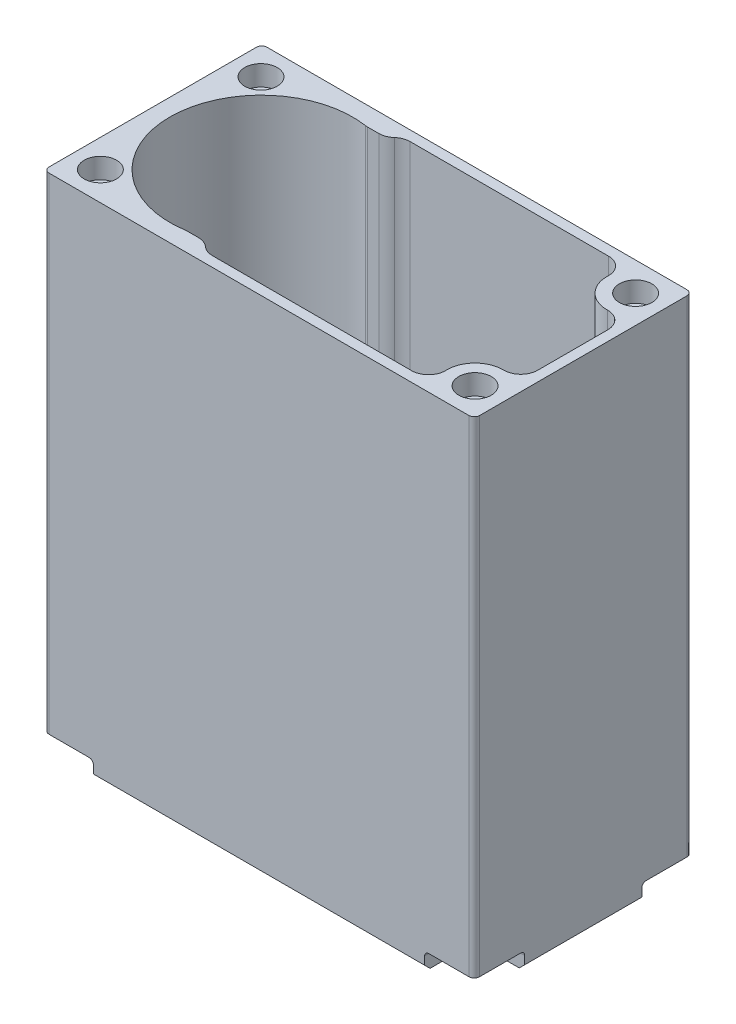
from build123d import *

# Parameters (mm, degrees)
SKETCH1_W             = 40.386
SKETCH1_H             = 20.447
BOSS_EXTRUDE1_DEPTH   = 47.244
FILLET1_R             = 0.508
CHAMFER1_SIZE         = 0.508
F_2_CLEARANCE_HOLE1_D = 2.2606
SKETCH6_R             = 8.5725
CUT_EXTRUDE1_DEPTH    = 45.974
SKETCH8_R             = 1.524
CUT_EXTRUDE2_DEPTH    = 1.905
CUT_EXTRUDE4_DEPTH    = 45.974
FILLET3_R             = 1.5875
FILLET6_R             = 1.5875
FILLET4_R             = 0.381
SKETCH9_R             = 1.1303
CUT_EXTRUDE5_DEPTH    = 1.651
FILLET5_R             = 0.381
CUT_EXTRUDE8_REACH    = 61.664
SKETCH12_R            = 7.62


with BuildPart() as part:
    # Sketch1 → Boss-Extrude1 (new body)
    with BuildSketch(Plane(origin=(0, 0, 0), x_dir=(1, 0, 0), z_dir=(0, 1, 0))):
        Rectangle(SKETCH1_W, SKETCH1_H)
    extrude(amount=BOSS_EXTRUDE1_DEPTH)

    # Fillet1
    fillet1_edges = [part.edges().sort_by_distance(p)[0] for p in [
        (20.193, 23.622, 10.2235),
        (-20.193, 23.622, 10.2235),
        (-20.193, 23.622, -10.2235),
        (20.193, 23.622, -10.2235),
    ]]
    fillet(fillet1_edges, radius=FILLET1_R)

    # Chamfer1
    chamfer1_edges = [part.edges().sort_by_distance(p)[0] for p in [
        (20.193, 0, 0),
        (0, 0, 10.2235),
        (-20.193, 0, 0),
        (0, 0, -10.2235),
        (-20.044210245, 0, 10.074710245),
        (-20.044210245, 0, -10.074710245),
        (20.044210245, 0, -10.074710245),
        (20.044210245, 0, 10.074710245),
    ]]
    chamfer(chamfer1_edges, length=CHAMFER1_SIZE)

    # #2 Clearance Hole1 (through all)
    with Locations(Plane(origin=(0, 47.244, 0), x_dir=(1, 0, 0), z_dir=(0, 1, 0))):
        with Locations((17.57045, -7.5311), (-17.57045, 7.5311), (-17.57045, -7.5311), (17.57045, 7.5311)):
            Hole(F_2_CLEARANCE_HOLE1_D / 2)

    # Sketch6 → Cut-Extrude1 (cut)
    with BuildSketch(Plane(origin=(0, 47.244, 0), x_dir=(1, 0, 0), z_dir=(0, 1, 0))):
        with Locations(Location((-10.014739789, 0, 0), (0, 0, 270))):
            Circle(SKETCH6_R)
    extrude(amount=-CUT_EXTRUDE1_DEPTH, mode=Mode.SUBTRACT)

    # Sketch8 → Cut-Extrude2 (cut)
    with BuildSketch(Plane(origin=(0, 47.244, 0), x_dir=(1, 0, 0), z_dir=(0, 1, 0))):
        with Locations(Location((-17.57045, -7.5311, 0), (0, 0, 270))):
            Circle(SKETCH8_R)
        with Locations(Location((-17.57045, 7.5311, 0), (0, 0, 270))):
            Circle(SKETCH8_R)
        with Locations(Location((17.57045, 7.5311, 0), (0, 0, 270))):
            Circle(SKETCH8_R)
        with Locations(Location((17.57045, -7.5311, 0), (0, 0, 270))):
            Circle(SKETCH8_R)
    extrude(amount=-CUT_EXTRUDE2_DEPTH, mode=Mode.SUBTRACT)

    # Sketch10 → Cut-Extrude4 (cut)
    with BuildSketch(Plane(origin=(0, 47.244, 0), x_dir=(1, 0, 0), z_dir=(0, 1, 0))):
        with BuildLine():
            Line((-6.70924359, 8.457326211), (-8.61424359, 8.457326211))
            ThreePointArc((-8.61424359, 8.457326211), (-3.476639533, 5.544456808), (-1.442239789, 0))
            ThreePointArc((-1.442239789, 0), (-3.476639533, -5.544456808), (-8.61424359, -8.457326211))
            Line((-8.61424359, -8.457326211), (-6.70924359, -8.457326211))
            Line((-6.70924359, -8.457326211), (-6.70924359, -9.271))
            Line((-6.70924359, -9.271), (15.608176703, -9.271))
            ThreePointArc((15.608176703, -9.271), (15.68428435, -5.70897277), (19.241559877, -5.509922056))
            Line((19.241559877, -5.509922056), (19.241559877, 5.420079029))
            ThreePointArc((19.241559877, 5.420079029), (15.63546106, 5.658979394), (15.51575641, 9.271))
            Line((15.51575641, 9.271), (-6.70924359, 9.271))
            Line((-6.70924359, 9.271), (-6.70924359, 8.457326211))
        make_face()
    extrude(amount=-CUT_EXTRUDE4_DEPTH, mode=Mode.SUBTRACT)

    # Fillet3
    # the kernel refuses this fillet: 1.5875 mm, written as the material it adds along each edge
    with BuildSketch(Plane(origin=(-6.70924359, 47.244, -9.271), x_dir=(0, 0, 1), z_dir=(0, -1, 0))) as fillet3_piece_1:
        with BuildLine():
            CenterArc((1.5875, -1.386127427), FILLET3_R, 119.173087397, 60.826912603)
            Line((0, -1.386127427), (0, 0))
            Line((0, 0), (0.813673789, 0))
        make_face()
    extrude(amount=45.974)
    with BuildSketch(Plane(origin=(-6.70924359, 47.244, 9.271), x_dir=(1, 0, 0), z_dir=(0, -1, 0))) as fillet3_piece_2:
        with BuildLine():
            CenterArc((1.386127427, -1.5875), FILLET3_R, 90, 60.826912603)
            Line((0, -0.813673789), (0, 0))
            Line((0, 0), (1.386127427, 0))
        make_face()
    extrude(amount=45.974)
    with BuildSketch(Plane(origin=(15.608176703, 47.244, 9.271), x_dir=(-0.3716686851547393, 0, -0.9283654390784629), z_dir=(0, -1, 0))) as fillet3_piece_3:
        with BuildLine():
            CenterArc((2.30818281, -1.494172552), FILLET3_R, 109.744057683, 92.074508599)
            Line((0.834402675, -2.08419659), (0, 0))
            ThreePointArc((0, 0), (0.885947491, -0.154176944), (1.771894982, 0))
        make_face()
    extrude(amount=45.974)
    with BuildSketch(Plane(origin=(19.241559877, 47.244, 5.509922056), x_dir=(0, 0, -1), z_dir=(0, -1, 0))) as fillet3_piece_4:
        with BuildLine():
            CenterArc((2.188041745, -1.5875), FILLET3_R, 90, 91.137945638)
            ThreePointArc((0.600854834, -1.619027103), (0.437513505, -0.758638036), (0, 0))
            Line((0, 0), (2.188041745, 0))
        make_face()
    extrude(amount=45.974)
    with BuildSketch(Plane(origin=(19.241559877, 47.244, -5.420079029), x_dir=(-0.9412204258380975, 0, 0.3377929987213328), z_dir=(0, -1, 0))) as fillet3_piece_5:
        with BuildLine():
            CenterArc((2.226543682, -1.504378109), FILLET3_R, 108.623097103, 91.119371442)
            Line((0.732356256, -2.040624495), (0, 0))
            ThreePointArc((0, 0), (0.859794646, -0.140974726), (1.719589292, 0))
        make_face()
    extrude(amount=45.974)
    with BuildSketch(Plane(origin=(15.51575641, 47.244, -9.271), x_dir=(-1, 0, 0), z_dir=(0, -1, 0))) as fillet3_piece_6:
        with BuildLine():
            CenterArc((2.222492196, -1.5875), FILLET3_R, 90, 92.040637192)
            ThreePointArc((0.635998952, -1.64402819), (0.456357894, -0.768489581), (0, 0))
            Line((0, 0), (2.222492196, 0))
        make_face()
    extrude(amount=45.974)
    # the kernel refuses this fillet: 1.5875 mm, written as the material it takes off along each edge
    with BuildSketch(Plane(origin=(-8.61424359, 47.55644078, -8.457326211), x_dir=(1, 0, 0), z_dir=(0, -1, 0))) as fillet3_2_piece_1:
        with BuildLine():
            CenterArc((0.124976312, -1.5875), FILLET3_R, 90, 8.635325681)
            ThreePointArc((-0.113378768, -0.017995904), (-0.05665926, -0.009187742), (0, 0))
            Line((0, 0), (0.124976312, 0))
        make_face()
    extrude(amount=46.28644078, mode=Mode.SUBTRACT)
    with BuildSketch(Plane(origin=(-8.61424359, 47.55644078, 8.457326211), x_dir=(-0.9876365067196718, 0, 0.15676138106869192), z_dir=(0, -1, 0))) as fillet3_2_piece_2:
        with BuildLine():
            CenterArc((0.125427524, -1.587464414), FILLET3_R, 90.383639208, 8.635325681)
            Line((-0.123431168, -0.019591459), (0, 0))
            ThreePointArc((0, 0), (0.057399036, -0.000192166), (0.114798073, 0))
        make_face()
    extrude(amount=46.28644078, mode=Mode.SUBTRACT)

    # Fillet6
    fillet6_edges = [part.edges().sort_by_distance(p)[0] for p in [
        (-6.70924359, 24.257, 8.457326211),
        (-6.70924359, 24.257, -8.457326211),
    ]]
    fillet(fillet6_edges, radius=FILLET6_R)

    # Fillet4
    fillet4_edges = [part.edges().sort_by_distance(p)[0] for p in [
        (3.985074025, 1.27, -9.271),
        (-18.587239789, 1.27, 0),
        (4.020021556, 1.27, 9.271),
        (15.700932918, 1.27, 5.691895176),
        (19.241559877, 1.27, 0.034931777),
        (15.651391563, 1.27, -5.642652893),
        (-7.967413131, 1.27, -8.457326211),
        (14.435607146, 1.27, -8.785865127),
        (18.765573215, 1.27, -4.385460337),
        (18.76538948, 1.27, 4.455504042),
        (14.505827999, 1.27, 8.785527421),
        (-5.891382637, 1.27, -9.165805456),
        (-8.60878401, 1.27, -8.461831581),
        (-8.60878401, 1.27, 8.461831581),
        (-5.891382637, 1.27, 9.165805456),
        (-7.967413131, 1.27, 8.457326211),
        (-6.877292509, 1.27, 8.562520755),
        (-6.877292509, 1.27, -8.562520755),
    ]]
    fillet(fillet4_edges, radius=FILLET4_R)

    # Sketch9 → Cut-Extrude5 (cut)
    # profile 1 of 8: a face of its own
    with BuildSketch(Plane.XZ):
        with BuildLine():
            Line((-19.685, 9.7155), (-19.685, 5.4991))
            Line((-19.685, 5.4991), (-17.57045, 5.4991))
            ThreePointArc((-17.57045, 5.4991), (-16.133609021, 6.094259021), (-15.53845, 7.5311))
            Line((-15.53845, 7.5311), (-15.53845, 9.7155))
            Line((-15.53845, 9.7155), (-19.685, 9.7155))
        make_face()
        with Locations(Location((-17.57045, 7.5311, 0), (0, 0, 90))):
            Circle(SKETCH9_R, mode=Mode.SUBTRACT)
    # profile 2 of 8: a face of its own
    with BuildSketch(Plane.XZ):
        with BuildLine():
            Line((-20.193, 5.4991), (-19.685, 5.4991))
            Line((-19.685, 5.4991), (-19.685, 9.7155))
            Line((-19.685, 9.7155), (-15.53845, 9.7155))
            Line((-15.53845, 9.7155), (-15.53845, 10.2235))
            Line((-15.53845, 10.2235), (-19.685, 10.2235))
            ThreePointArc((-19.685, 10.2235), (-20.044210245, 10.074710245), (-20.193, 9.7155))
            Line((-20.193, 9.7155), (-20.193, 5.4991))
        make_face()
    # profile 3 of 8: a face of its own
    with BuildSketch(Plane.XZ):
        with BuildLine():
            ThreePointArc((-15.53845, -7.5311), (-16.133609021, -6.094259021), (-17.57045, -5.4991))
            Line((-17.57045, -5.4991), (-19.685, -5.4991))
            Line((-19.685, -5.4991), (-19.685, -9.7155))
            Line((-19.685, -9.7155), (-15.53845, -9.7155))
            Line((-15.53845, -9.7155), (-15.53845, -7.5311))
        make_face()
        with Locations(Location((-17.57045, -7.5311, 0), (0, 0, 90))):
            Circle(SKETCH9_R, mode=Mode.SUBTRACT)
    # profile 4 of 8: a face of its own
    with BuildSketch(Plane.XZ):
        with BuildLine():
            Line((-19.685, -9.7155), (-19.685, -5.4991))
            Line((-19.685, -5.4991), (-20.193, -5.4991))
            Line((-20.193, -5.4991), (-20.193, -9.7155))
            ThreePointArc((-20.193, -9.7155), (-20.044210245, -10.074710245), (-19.685, -10.2235))
            Line((-19.685, -10.2235), (-15.53845, -10.2235))
            Line((-15.53845, -10.2235), (-15.53845, -9.7155))
            Line((-15.53845, -9.7155), (-19.685, -9.7155))
        make_face()
    # profile 5 of 8: a face of its own
    with BuildSketch(Plane.XZ):
        with BuildLine():
            Line((19.685, 9.7155), (15.53845, 9.7155))
            Line((15.53845, 9.7155), (15.53845, 7.5311))
            ThreePointArc((15.53845, 7.5311), (16.133609021, 6.094259021), (17.57045, 5.4991))
            Line((17.57045, 5.4991), (19.685, 5.4991))
            Line((19.685, 5.4991), (19.685, 9.7155))
        make_face()
        with Locations(Location((17.57045, 7.5311, 0), (0, 0, 90))):
            Circle(SKETCH9_R, mode=Mode.SUBTRACT)
    # profile 6 of 8: a face of its own
    with BuildSketch(Plane.XZ):
        with BuildLine():
            Line((15.53845, 10.2235), (15.53845, 9.7155))
            Line((15.53845, 9.7155), (19.685, 9.7155))
            Line((19.685, 9.7155), (19.685, 5.4991))
            Line((19.685, 5.4991), (20.193, 5.4991))
            Line((20.193, 5.4991), (20.193, 9.7155))
            ThreePointArc((20.193, 9.7155), (20.044210245, 10.074710245), (19.685, 10.2235))
            Line((19.685, 10.2235), (15.53845, 10.2235))
        make_face()
    # profile 7 of 8: a face of its own
    with BuildSketch(Plane.XZ):
        with BuildLine():
            Line((15.53845, -7.5311), (15.53845, -9.7155))
            Line((15.53845, -9.7155), (19.685, -9.7155))
            Line((19.685, -9.7155), (19.685, -5.4991))
            Line((19.685, -5.4991), (17.57045, -5.4991))
            ThreePointArc((17.57045, -5.4991), (16.133609021, -6.094259021), (15.53845, -7.5311))
        make_face()
        with Locations(Location((17.57045, -7.5311, 0), (0, 0, 90))):
            Circle(SKETCH9_R, mode=Mode.SUBTRACT)
    # profile 8 of 8: a face of its own
    with BuildSketch(Plane.XZ):
        with BuildLine():
            Line((19.685, -9.7155), (15.53845, -9.7155))
            Line((15.53845, -9.7155), (15.53845, -10.2235))
            Line((15.53845, -10.2235), (19.685, -10.2235))
            ThreePointArc((19.685, -10.2235), (20.044210245, -10.074710245), (20.193, -9.7155))
            Line((20.193, -9.7155), (20.193, -5.4991))
            Line((20.193, -5.4991), (19.685, -5.4991))
            Line((19.685, -5.4991), (19.685, -9.7155))
        make_face()
    extrude(amount=-CUT_EXTRUDE5_DEPTH, mode=Mode.SUBTRACT)

    # Fillet5
    fillet5_edges = [part.edges().sort_by_distance(p)[0] for p in [
        (-18.881725, 1.651, -5.4991),
        (-16.133609021, 1.651, -6.094259021),
        (-15.53845, 1.651, -8.8773),
        (18.881725, 1.651, 5.4991),
        (16.133609021, 1.651, 6.094259021),
        (15.53845, 1.651, 8.8773),
        (15.53845, 1.651, -8.8773),
        (16.133609021, 1.651, -6.094259021),
        (18.881725, 1.651, -5.4991),
        (-15.53845, 1.651, 8.8773),
        (-16.133609021, 1.651, 6.094259021),
        (-18.881725, 1.651, 5.4991),
    ]]
    fillet(fillet5_edges, radius=FILLET5_R)

    # Sketch12 → Cut-Extrude8 (cut, up to next)
    with BuildSketch(Plane(origin=(9.9695, 0, -10.2235), x_dir=(1, 0, 0), z_dir=(0, 0, 1)), mode=Mode.PRIVATE) as cut_extrude8_sk1:
        with Locations(Location((-5.984425975, 12.336581723, 0), (0, 0, 180))):
            Circle(SKETCH12_R)
    cut_extrude8_tool1 = extrude(cut_extrude8_sk1.sketch, amount=CUT_EXTRUDE8_REACH, mode=Mode.PRIVATE) & part.part
    add(cut_extrude8_tool1.solids().sort_by_distance((3.985074, 12.336582, -10.2235))[0], mode=Mode.SUBTRACT)


solid = part.part
